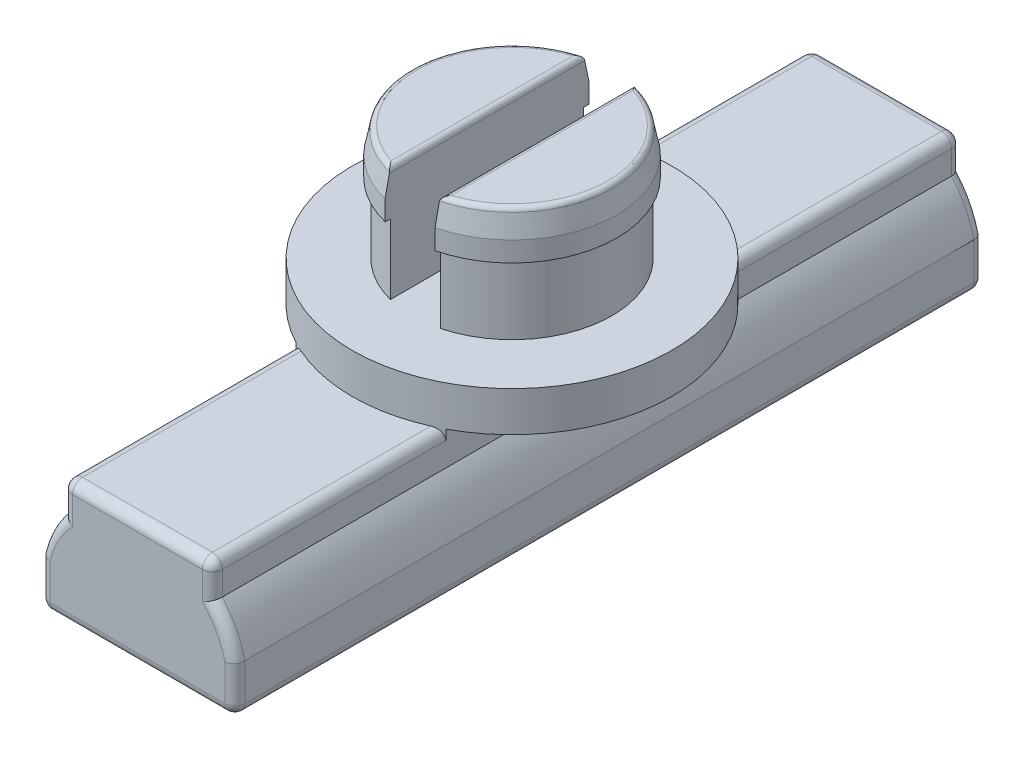
from build123d import *

# Parameters (mm, degrees)
EXTRUDE_2_DEPTH      = 7.5
EXTRUDE_2_DEPTH_BACK = 7.5
SKETCH_3_R           = 3.2
EXTRUDE_3_DEPTH      = 0.8
SKETCH_4_R           = 2
EXTRUDE_4_DEPTH      = 2.3
CUT_EXTRUDE_1_REACH  = 11.892
SKETCH_6_W           = 1
SKETCH_6_H           = 4.523529097
FILLET_1_R           = 0.2
FILLET_2_R           = 0.1


with BuildPart() as part:
    # 草图2 → 凸台-拉伸2 (new, two sides: drawn at the far end of the back side and taken through both)
    with BuildSketch(Plane.XY.offset(-EXTRUDE_2_DEPTH_BACK)):
        with BuildLine():
            Line((-1.95, -2.5), (1.95, -2.5))
            Line((1.95, -2.5), (1.95, -1.555590279))
            ThreePointArc((1.95, -1.555590279), (1.780042303, -1.088161527), (1.5, -0.677124344))
            Line((1.5, -0.677124344), (1.5, 0))
            Line((1.5, 0), (-1.5, 0))
            Line((-1.5, 0), (-1.5, -0.677124344))
            ThreePointArc((-1.5, -0.677124344), (-1.780042303, -1.088161527), (-1.95, -1.555590279))
            Line((-1.95, -1.555590279), (-1.95, -2.5))
        make_face()
    extrude(amount=EXTRUDE_2_DEPTH + EXTRUDE_2_DEPTH_BACK)

    # 草图3 → 凸台-拉伸3 (add)
    with BuildSketch(Plane(origin=(0, 0, 0), x_dir=(1, 0, 0), z_dir=(0, 1, 0))):
        with Locations(Location((0, 0, 0), (0, 0, 62.046813117))):
            Circle(SKETCH_3_R)
    extrude(amount=EXTRUDE_3_DEPTH)

    # 草图4 → 凸台-拉伸4 (add)
    with BuildSketch(Plane(origin=(0, 0.8, 0), x_dir=(1, 0, 0), z_dir=(0, 1, 0))):
        with Locations(Location((0, 0, 0), (0, 0, 270))):
            Circle(SKETCH_4_R)
    extrude(amount=EXTRUDE_4_DEPTH)

    # 草图5 → 旋转1 (revolve)
    with BuildSketch(Plane(origin=(0, 0, 0), x_dir=(0, 0, -1), z_dir=(1, 0, 0))):
        Polygon((-2, 3.1), (-2, 2.2), (-2.1, 2.2), (-2.1, 2.6), align=None)
    revolve(axis=Axis((0, 3.426926784, 0), (0, -1, 0)))

    # 切除-拉伸1: up to this face of the body (flat: up to its plane)
    cut_extrude_1_end = Plane(part.part.faces().sort_by_distance((-1.457573593, 0.8, 2.746708821))[0])
    # 草图6 → 切除-拉伸1 (cut, up to the picked face)
    with BuildSketch(Plane(origin=(0, 3.1, 0), x_dir=(1, 0, 0), z_dir=(0, 1, 0)), mode=Mode.PRIVATE) as cut_extrude_1_sk1:
        with Locations((0, 0.078661768)):
            Rectangle(SKETCH_6_W, SKETCH_6_H)
    cut_extrude_1_tool1 = split(extrude(cut_extrude_1_sk1.sketch, amount=-CUT_EXTRUDE_1_REACH, mode=Mode.PRIVATE), bisect_by=cut_extrude_1_end, keep=Keep.BOTH, mode=Mode.PRIVATE)
    add(cut_extrude_1_tool1.solids().sort_by(Axis((0, 3.1, -0.078662), (0, -1, 0)))[0], mode=Mode.SUBTRACT)

    # 圆角1
    # the kernel refuses this fillet: 0.2 mm, written as the material it takes off along each edge
    with BuildSketch(Plane(origin=(-1.75, -2.3, -7.3), x_dir=(0, -1, 0), z_dir=(-1, 0, 0))) as fillet_1_piece_1_section:
        Polygon((0, 0), (FILLET_1_R * 1.02, 0), (FILLET_1_R * 1.02, -FILLET_1_R * 1.02), (0, -FILLET_1_R * 1.02), align=None)
    fillet_1_piece_1 = extrude(amount=FILLET_1_R * 1.02, mode=Mode.PRIVATE)
    fillet_1_piece_1 = fillet_1_piece_1 - Plane(origin=(-1.75, -2.3, -7.3), x_dir=(0, 0.7071067811865475, 0.7071067811865475), z_dir=(-1, 0, 0)) * Sphere(FILLET_1_R, mode=Mode.PRIVATE)
    add(fillet_1_piece_1, mode=Mode.SUBTRACT)
    with BuildSketch(Plane(origin=(1.75, -2.3, -7.3), x_dir=(0, 0, -1), z_dir=(0, -1, 0))) as fillet_1_piece_2_section:
        Polygon((0, 0), (FILLET_1_R * 1.02, 0), (FILLET_1_R * 1.02, FILLET_1_R * 1.02), (0, FILLET_1_R * 1.02), align=None)
    fillet_1_piece_2 = extrude(amount=FILLET_1_R * 1.02, mode=Mode.PRIVATE)
    fillet_1_piece_2 = fillet_1_piece_2 - Plane(origin=(1.75, -2.3, -7.3), x_dir=(-0.7071067811865475, 0, 0.7071067811865475), z_dir=(0, -1, 0)) * Sphere(FILLET_1_R, mode=Mode.PRIVATE)
    add(fillet_1_piece_2, mode=Mode.SUBTRACT)
    with BuildSketch(Plane(origin=(-1.3, -0.2, -7.3), x_dir=(0, 0, -1), z_dir=(0, 1, 0))) as fillet_1_piece_3_section:
        Polygon((0, 0), (FILLET_1_R * 1.02, 0), (FILLET_1_R * 1.02, FILLET_1_R * 1.02), (0, FILLET_1_R * 1.02), align=None)
    fillet_1_piece_3 = extrude(amount=FILLET_1_R * 1.02, mode=Mode.PRIVATE)
    fillet_1_piece_3 = fillet_1_piece_3 - Plane(origin=(-1.3, -0.2, -7.3), x_dir=(0.7071067811865475, 0, 0.7071067811865475), z_dir=(0, 1, 0)) * Sphere(FILLET_1_R, mode=Mode.PRIVATE)
    add(fillet_1_piece_3, mode=Mode.SUBTRACT)
    with BuildSketch(Plane(origin=(1.3, -0.2, -7.3), x_dir=(0, 1, 0), z_dir=(1, 0, 0))) as fillet_1_piece_4_section:
        Polygon((0, 0), (FILLET_1_R * 1.02, 0), (FILLET_1_R * 1.02, -FILLET_1_R * 1.02), (0, -FILLET_1_R * 1.02), align=None)
    fillet_1_piece_4 = extrude(amount=FILLET_1_R * 1.02, mode=Mode.PRIVATE)
    fillet_1_piece_4 = fillet_1_piece_4 - Plane(origin=(1.3, -0.2, -7.3), x_dir=(0, -0.7071067811865475, 0.7071067811865475), z_dir=(1, 0, 0)) * Sphere(FILLET_1_R, mode=Mode.PRIVATE)
    add(fillet_1_piece_4, mode=Mode.SUBTRACT)
    with BuildSketch(Plane(origin=(1.75, -2.3, 7.3), x_dir=(0, -1, 0), z_dir=(0, 0, 1))) as fillet_1_piece_5_section:
        Polygon((0, 0), (FILLET_1_R * 1.02, 0), (FILLET_1_R * 1.02, FILLET_1_R * 1.02), (0, FILLET_1_R * 1.02), align=None)
    fillet_1_piece_5 = extrude(amount=FILLET_1_R * 1.02, mode=Mode.PRIVATE)
    fillet_1_piece_5 = fillet_1_piece_5 - Plane(origin=(1.75, -2.3, 7.3), x_dir=(-0.7071067811865478, 0.7071067811865472, 0), z_dir=(0, 0, 1)) * Sphere(FILLET_1_R, mode=Mode.PRIVATE)
    add(fillet_1_piece_5, mode=Mode.SUBTRACT)
    with BuildSketch(Plane(origin=(-1.75, -2.3, 7.3), x_dir=(0, 0, 1), z_dir=(-1, 0, 0))) as fillet_1_piece_6_section:
        Polygon((0, 0), (FILLET_1_R * 1.02, 0), (FILLET_1_R * 1.02, -FILLET_1_R * 1.02), (0, -FILLET_1_R * 1.02), align=None)
    fillet_1_piece_6 = extrude(amount=FILLET_1_R * 1.02, mode=Mode.PRIVATE)
    fillet_1_piece_6 = fillet_1_piece_6 - Plane(origin=(-1.75, -2.3, 7.3), x_dir=(0, 0.7071067811865475, -0.7071067811865475), z_dir=(-1, 0, 0)) * Sphere(FILLET_1_R, mode=Mode.PRIVATE)
    add(fillet_1_piece_6, mode=Mode.SUBTRACT)
    with BuildSketch(Plane(origin=(-1.3, -0.2, 7.3), x_dir=(0, 0, 1), z_dir=(0, 1, 0))) as fillet_1_piece_7_section:
        Polygon((0, 0), (FILLET_1_R * 1.02, 0), (FILLET_1_R * 1.02, -FILLET_1_R * 1.02), (0, -FILLET_1_R * 1.02), align=None)
    fillet_1_piece_7 = extrude(amount=FILLET_1_R * 1.02, mode=Mode.PRIVATE)
    fillet_1_piece_7 = fillet_1_piece_7 - Plane(origin=(-1.3, -0.2, 7.3), x_dir=(0.7071067811865475, 0, -0.7071067811865475), z_dir=(0, 1, 0)) * Sphere(FILLET_1_R, mode=Mode.PRIVATE)
    add(fillet_1_piece_7, mode=Mode.SUBTRACT)
    with BuildSketch(Plane(origin=(1.3, -0.2, 7.3), x_dir=(0, 1, 0), z_dir=(1, 0, 0))) as fillet_1_piece_8_section:
        Polygon((0, 0), (FILLET_1_R * 1.02, 0), (FILLET_1_R * 1.02, FILLET_1_R * 1.02), (0, FILLET_1_R * 1.02), align=None)
    fillet_1_piece_8 = extrude(amount=FILLET_1_R * 1.02, mode=Mode.PRIVATE)
    fillet_1_piece_8 = fillet_1_piece_8 - Plane(origin=(1.3, -0.2, 7.3), x_dir=(0, -0.7071067811865475, -0.7071067811865475), z_dir=(1, 0, 0)) * Sphere(FILLET_1_R, mode=Mode.PRIVATE)
    add(fillet_1_piece_8, mode=Mode.SUBTRACT)
    with BuildSketch(Plane(origin=(-1.95, -1.055590279, -7.5), x_dir=(0, 0, 1), z_dir=(0, -1, 0))) as fillet_1_piece_9_section:
        with BuildLine():
            CenterArc((FILLET_1_R, -FILLET_1_R), FILLET_1_R, 90, 90)
            Line((0, -FILLET_1_R), (-FILLET_1_R * 0.02, -FILLET_1_R))
            Line((-FILLET_1_R * 0.02, -FILLET_1_R), (-FILLET_1_R * 0.02, FILLET_1_R * 0.02))
            Line((-FILLET_1_R * 0.02, FILLET_1_R * 0.02), (FILLET_1_R, FILLET_1_R * 0.02))
            Line((FILLET_1_R, FILLET_1_R * 0.02), (FILLET_1_R, 0))
        make_face()
    fillet_1_piece_9 = extrude(amount=1.244409721, mode=Mode.PRIVATE)
    fillet_1_piece_9 = fillet_1_piece_9 & Plane(origin=(0, -2, -7.458467961), x_dir=(-0.7500000000000003, 0.6614378277661473, 0), z_dir=(0, 0, -1)) * Cylinder(2, 4, mode=Mode.PRIVATE)
    add(fillet_1_piece_9, mode=Mode.SUBTRACT)
    with BuildSketch(Plane(origin=(-1.75, -2.5, -7.5), x_dir=(0, 0, 1), z_dir=(1, 0, 0)), Plane(origin=(-1.75, -2.5, 7.5), x_dir=(0, 1, 0), z_dir=(1, 0, 0))) as fillet_1_piece_10:
        with BuildLine():
            CenterArc((FILLET_1_R, -FILLET_1_R), FILLET_1_R, 90, 90)
            Line((0, -FILLET_1_R), (-FILLET_1_R * 0.02, -FILLET_1_R))
            Line((-FILLET_1_R * 0.02, -FILLET_1_R), (-FILLET_1_R * 0.02, FILLET_1_R * 0.02))
            Line((-FILLET_1_R * 0.02, FILLET_1_R * 0.02), (FILLET_1_R, FILLET_1_R * 0.02))
            Line((FILLET_1_R, FILLET_1_R * 0.02), (FILLET_1_R, 0))
        make_face()
    extrude(amount=3.5, mode=Mode.SUBTRACT)
    with BuildSketch(Plane(origin=(-1.5, 0, -2.326658805), x_dir=(0, -1, 0), z_dir=(0, 0, -1))) as fillet_1_piece_11_section:
        with BuildLine():
            CenterArc((FILLET_1_R, -FILLET_1_R), FILLET_1_R, 90, 90)
            Line((0, -FILLET_1_R), (-FILLET_1_R * 0.02, -FILLET_1_R))
            Line((-FILLET_1_R * 0.02, -FILLET_1_R), (-FILLET_1_R * 0.02, FILLET_1_R * 0.02))
            Line((-FILLET_1_R * 0.02, FILLET_1_R * 0.02), (FILLET_1_R, FILLET_1_R * 0.02))
            Line((FILLET_1_R, FILLET_1_R * 0.02), (FILLET_1_R, 0))
        make_face()
    fillet_1_piece_11 = extrude(amount=4.973341195, mode=Mode.PRIVATE)
    fillet_1_piece_11 = split(fillet_1_piece_11, bisect_by=Plane(origin=(-1.459470177, 0, -5.073738794), z_dir=(0, -1, 0)), keep=Keep.TOP, mode=Mode.PRIVATE)
    fillet_1_piece_11 = fillet_1_piece_11 - Plane(origin=(0, -0.049499439, 0), x_dir=(0.46874999999412414, 0, -0.8833308765720287), z_dir=(0, -1, 0)) * Cylinder(3.2, 11, mode=Mode.PRIVATE)
    add(fillet_1_piece_11, mode=Mode.SUBTRACT)
    with BuildSketch(Plane(origin=(1.5, 0, -7.3), x_dir=(0, -1, 0), z_dir=(0, 0, 1))) as fillet_1_piece_12_section:
        with BuildLine():
            CenterArc((FILLET_1_R, -FILLET_1_R), FILLET_1_R, 90, 90)
            Line((0, -FILLET_1_R), (-FILLET_1_R * 0.02, -FILLET_1_R))
            Line((-FILLET_1_R * 0.02, -FILLET_1_R), (-FILLET_1_R * 0.02, FILLET_1_R * 0.02))
            Line((-FILLET_1_R * 0.02, FILLET_1_R * 0.02), (FILLET_1_R, FILLET_1_R * 0.02))
            Line((FILLET_1_R, FILLET_1_R * 0.02), (FILLET_1_R, 0))
        make_face()
    fillet_1_piece_12 = extrude(amount=4.973341195, mode=Mode.PRIVATE)
    fillet_1_piece_12 = split(fillet_1_piece_12, bisect_by=Plane(origin=(1.459470177, 0, -5.073738786), z_dir=(0, -1, 0)), keep=Keep.TOP, mode=Mode.PRIVATE)
    fillet_1_piece_12 = fillet_1_piece_12 - Plane(origin=(0, -0.04949944, 0), x_dir=(0.46874999999412414, 0, -0.8833308765720287), z_dir=(0, -1, 0)) * Cylinder(3.2, 11, mode=Mode.PRIVATE)
    add(fillet_1_piece_12, mode=Mode.SUBTRACT)
    with BuildSketch(Plane(origin=(1.95, -2.5, -7.3), x_dir=(-1, 0, 0), z_dir=(0, 0, 1)), Plane(origin=(-1.95, -2.5, -7.3), x_dir=(0, 1, 0), z_dir=(0, 0, 1))) as fillet_1_piece_13:
        with BuildLine():
            CenterArc((FILLET_1_R, -FILLET_1_R), FILLET_1_R, 90, 90)
            Line((0, -FILLET_1_R), (-FILLET_1_R * 0.02, -FILLET_1_R))
            Line((-FILLET_1_R * 0.02, -FILLET_1_R), (-FILLET_1_R * 0.02, FILLET_1_R * 0.02))
            Line((-FILLET_1_R * 0.02, FILLET_1_R * 0.02), (FILLET_1_R, FILLET_1_R * 0.02))
            Line((FILLET_1_R, FILLET_1_R * 0.02), (FILLET_1_R, 0))
        make_face()
    extrude(amount=14.6, mode=Mode.SUBTRACT)
    with BuildSketch(Plane(origin=(1.95, -2.3, -7.5), x_dir=(-1, 0, 0), z_dir=(0, 1, 0))) as fillet_1_piece_14_section:
        with BuildLine():
            CenterArc((FILLET_1_R, FILLET_1_R), FILLET_1_R, 180, 90)
            Line((0, FILLET_1_R), (-FILLET_1_R * 0.02, FILLET_1_R))
            Line((-FILLET_1_R * 0.02, FILLET_1_R), (-FILLET_1_R * 0.02, -FILLET_1_R * 0.02))
            Line((-FILLET_1_R * 0.02, -FILLET_1_R * 0.02), (FILLET_1_R, -FILLET_1_R * 0.02))
            Line((FILLET_1_R, -FILLET_1_R * 0.02), (FILLET_1_R, 0))
        make_face()
    fillet_1_piece_14 = extrude(amount=1.244409721, mode=Mode.PRIVATE)
    fillet_1_piece_14 = fillet_1_piece_14 & Plane(origin=(0, -2, -7.458467726), x_dir=(0.9749999999999994, 0.22220486043289284, 0), z_dir=(0, 0, -1)) * Cylinder(2, 4, mode=Mode.PRIVATE)
    add(fillet_1_piece_14, mode=Mode.SUBTRACT)
    with BuildSketch(Plane(origin=(0, -2, -7.5), x_dir=(0.9996637110682526, -0.025931925752815457, 0), z_dir=(-0.025931925752815457, -0.9996637110682526, 0))) as fillet_1_piece_15_section:
        with BuildLine():
            CenterArc((2 - FILLET_1_R, FILLET_1_R), FILLET_1_R, 270, 90)
            Line((2, FILLET_1_R), (2 + FILLET_1_R * 0.02, FILLET_1_R))
            Line((2 + FILLET_1_R * 0.02, FILLET_1_R), (2 + FILLET_1_R * 0.02, -FILLET_1_R * 0.02))
            Line((2 + FILLET_1_R * 0.02, -FILLET_1_R * 0.02), (2 - FILLET_1_R, -FILLET_1_R * 0.02))
            Line((2 - FILLET_1_R, -FILLET_1_R * 0.02), (2 - FILLET_1_R, 0))
        make_face()
    fillet_1_piece_15 = revolve(axis=Axis((0, -2, -7.5), (0, 0, 1)), revolution_arc=57.220103199, mode=Mode.PRIVATE)
    fillet_1_piece_15 = split(fillet_1_piece_15, bisect_by=Plane(origin=(1.95, -1.33665989, -7.443033327), z_dir=(-1, 0, 0)), keep=Keep.TOP, mode=Mode.PRIVATE)
    fillet_1_piece_15 = split(fillet_1_piece_15, bisect_by=Plane(origin=(1.5, -1.33665989, -7.443033327), z_dir=(1, 0, 0)), keep=Keep.TOP, mode=Mode.PRIVATE)
    add(fillet_1_piece_15, mode=Mode.SUBTRACT)
    with BuildSketch(Plane(origin=(1.5, -1.177124344, -7.5), x_dir=(-1, 0, 0), z_dir=(0, 1, 0))) as fillet_1_piece_16_section:
        with BuildLine():
            CenterArc((FILLET_1_R, FILLET_1_R), FILLET_1_R, 180, 90)
            Line((0, FILLET_1_R), (-FILLET_1_R * 0.02, FILLET_1_R))
            Line((-FILLET_1_R * 0.02, FILLET_1_R), (-FILLET_1_R * 0.02, -FILLET_1_R * 0.02))
            Line((-FILLET_1_R * 0.02, -FILLET_1_R * 0.02), (FILLET_1_R, -FILLET_1_R * 0.02))
            Line((FILLET_1_R, -FILLET_1_R * 0.02), (FILLET_1_R, 0))
        make_face()
    fillet_1_piece_16 = extrude(amount=0.977124344, mode=Mode.PRIVATE)
    fillet_1_piece_16 = fillet_1_piece_16 - Plane(origin=(0, -2, -7.452053355), x_dir=(0.9749999999999994, 0.22220486043289284, 0), z_dir=(0, 0, -1)) * Cylinder(2, 3, mode=Mode.PRIVATE)
    add(fillet_1_piece_16, mode=Mode.SUBTRACT)
    with BuildSketch(Plane(origin=(-1.5, -0.2, 7.5), x_dir=(1, 0, 0), z_dir=(0, -1, 0))) as fillet_1_piece_17_section:
        with BuildLine():
            CenterArc((FILLET_1_R, -FILLET_1_R), FILLET_1_R, 90, 90)
            Line((0, -FILLET_1_R), (-FILLET_1_R * 0.02, -FILLET_1_R))
            Line((-FILLET_1_R * 0.02, -FILLET_1_R), (-FILLET_1_R * 0.02, FILLET_1_R * 0.02))
            Line((-FILLET_1_R * 0.02, FILLET_1_R * 0.02), (FILLET_1_R, FILLET_1_R * 0.02))
            Line((FILLET_1_R, FILLET_1_R * 0.02), (FILLET_1_R, 0))
        make_face()
    fillet_1_piece_17 = extrude(amount=0.977124344, mode=Mode.PRIVATE)
    fillet_1_piece_17 = fillet_1_piece_17 - Plane(origin=(0, -2, 7.452053317), x_dir=(-0.7500000000000003, 0.6614378277661473, 0), z_dir=(0, 0, -1)) * Cylinder(2, 3, mode=Mode.PRIVATE)
    add(fillet_1_piece_17, mode=Mode.SUBTRACT)
    with BuildSketch(Plane(origin=(0, -2, 7.5), x_dir=(-0.5630336167990329, 0.8264339939488209, 0), z_dir=(0.8264339939488209, 0.5630336167990329, 0))) as fillet_1_piece_18_section:
        with BuildLine():
            CenterArc((2 - FILLET_1_R, -FILLET_1_R), FILLET_1_R, 0, 90)
            Line((2 - FILLET_1_R, 0), (2 - FILLET_1_R, FILLET_1_R * 0.02))
            Line((2 - FILLET_1_R, FILLET_1_R * 0.02), (2 + FILLET_1_R * 0.02, FILLET_1_R * 0.02))
            Line((2 + FILLET_1_R * 0.02, FILLET_1_R * 0.02), (2 + FILLET_1_R * 0.02, -FILLET_1_R))
            Line((2 + FILLET_1_R * 0.02, -FILLET_1_R), (2, -FILLET_1_R))
        make_face()
    fillet_1_piece_18 = revolve(axis=Axis((0, -2, 7.5), (0, 0, 1)), revolution_arc=57.220103199, mode=Mode.PRIVATE)
    fillet_1_piece_18 = split(fillet_1_piece_18, bisect_by=Plane(origin=(-1.95, -1.33665989, 7.443033328), z_dir=(1, 0, 0)), keep=Keep.TOP, mode=Mode.PRIVATE)
    fillet_1_piece_18 = split(fillet_1_piece_18, bisect_by=Plane(origin=(-1.5, -1.33665989, 7.443033328), z_dir=(-1, 0, 0)), keep=Keep.TOP, mode=Mode.PRIVATE)
    add(fillet_1_piece_18, mode=Mode.SUBTRACT)
    with BuildSketch(Plane(origin=(-1.95, -1.055590279, 7.5), x_dir=(0, 0, -1), z_dir=(0, -1, 0))) as fillet_1_piece_19_section:
        with BuildLine():
            CenterArc((FILLET_1_R, FILLET_1_R), FILLET_1_R, 180, 90)
            Line((0, FILLET_1_R), (-FILLET_1_R * 0.02, FILLET_1_R))
            Line((-FILLET_1_R * 0.02, FILLET_1_R), (-FILLET_1_R * 0.02, -FILLET_1_R * 0.02))
            Line((-FILLET_1_R * 0.02, -FILLET_1_R * 0.02), (FILLET_1_R, -FILLET_1_R * 0.02))
            Line((FILLET_1_R, -FILLET_1_R * 0.02), (FILLET_1_R, 0))
        make_face()
    fillet_1_piece_19 = extrude(amount=1.244409721, mode=Mode.PRIVATE)
    fillet_1_piece_19 = fillet_1_piece_19 & Plane(origin=(0, -2, 7.458467961), x_dir=(-0.7500000000000003, 0.6614378277661473, 0), z_dir=(0, 0, -1)) * Cylinder(2, 4, mode=Mode.PRIVATE)
    add(fillet_1_piece_19, mode=Mode.SUBTRACT)
    with BuildSketch(Plane(origin=(1.95, -2.3, 7.5), x_dir=(-1, 0, 0), z_dir=(0, 1, 0))) as fillet_1_piece_20_section:
        with BuildLine():
            CenterArc((FILLET_1_R, -FILLET_1_R), FILLET_1_R, 90, 90)
            Line((0, -FILLET_1_R), (-FILLET_1_R * 0.02, -FILLET_1_R))
            Line((-FILLET_1_R * 0.02, -FILLET_1_R), (-FILLET_1_R * 0.02, FILLET_1_R * 0.02))
            Line((-FILLET_1_R * 0.02, FILLET_1_R * 0.02), (FILLET_1_R, FILLET_1_R * 0.02))
            Line((FILLET_1_R, FILLET_1_R * 0.02), (FILLET_1_R, 0))
        make_face()
    fillet_1_piece_20 = extrude(amount=1.244409721, mode=Mode.PRIVATE)
    fillet_1_piece_20 = fillet_1_piece_20 & Plane(origin=(0, -2, 7.458467726), x_dir=(0.9749999999999994, 0.22220486043289284, 0), z_dir=(0, 0, -1)) * Cylinder(2, 4, mode=Mode.PRIVATE)
    add(fillet_1_piece_20, mode=Mode.SUBTRACT)
    with BuildSketch(Plane(origin=(0, -2, 7.5), x_dir=(0.9996637110682526, -0.025931925752815457, 0), z_dir=(-0.025931925752815457, -0.9996637110682526, 0))) as fillet_1_piece_21_section:
        with BuildLine():
            CenterArc((2 - FILLET_1_R, -FILLET_1_R), FILLET_1_R, 0, 90)
            Line((2, -FILLET_1_R), (2 + FILLET_1_R * 0.02, -FILLET_1_R))
            Line((2 + FILLET_1_R * 0.02, -FILLET_1_R), (2 + FILLET_1_R * 0.02, FILLET_1_R * 0.02))
            Line((2 + FILLET_1_R * 0.02, FILLET_1_R * 0.02), (2 - FILLET_1_R, FILLET_1_R * 0.02))
            Line((2 - FILLET_1_R, FILLET_1_R * 0.02), (2 - FILLET_1_R, 0))
        make_face()
    fillet_1_piece_21 = revolve(axis=Axis((0, -2, 7.5), (0, 0, 1)), revolution_arc=57.220103199, mode=Mode.PRIVATE)
    fillet_1_piece_21 = split(fillet_1_piece_21, bisect_by=Plane(origin=(1.95, -1.33665989, 7.443033327), z_dir=(-1, 0, 0)), keep=Keep.TOP, mode=Mode.PRIVATE)
    fillet_1_piece_21 = split(fillet_1_piece_21, bisect_by=Plane(origin=(1.5, -1.33665989, 7.443033327), z_dir=(1, 0, 0)), keep=Keep.TOP, mode=Mode.PRIVATE)
    add(fillet_1_piece_21, mode=Mode.SUBTRACT)
    with BuildSketch(Plane(origin=(1.5, -1.177124344, 7.5), x_dir=(-1, 0, 0), z_dir=(0, 1, 0))) as fillet_1_piece_22_section:
        with BuildLine():
            CenterArc((FILLET_1_R, -FILLET_1_R), FILLET_1_R, 90, 90)
            Line((0, -FILLET_1_R), (-FILLET_1_R * 0.02, -FILLET_1_R))
            Line((-FILLET_1_R * 0.02, -FILLET_1_R), (-FILLET_1_R * 0.02, FILLET_1_R * 0.02))
            Line((-FILLET_1_R * 0.02, FILLET_1_R * 0.02), (FILLET_1_R, FILLET_1_R * 0.02))
            Line((FILLET_1_R, FILLET_1_R * 0.02), (FILLET_1_R, 0))
        make_face()
    fillet_1_piece_22 = extrude(amount=0.977124344, mode=Mode.PRIVATE)
    fillet_1_piece_22 = fillet_1_piece_22 - Plane(origin=(0, -2, 7.452053355), x_dir=(0.9749999999999994, 0.22220486043289284, 0), z_dir=(0, 0, -1)) * Cylinder(2, 3, mode=Mode.PRIVATE)
    add(fillet_1_piece_22, mode=Mode.SUBTRACT)
    with BuildSketch(Plane(origin=(1.3, 0, 7.5), x_dir=(0, -1, 0), z_dir=(-1, 0, 0))) as fillet_1_piece_23:
        with BuildLine():
            CenterArc((FILLET_1_R, -FILLET_1_R), FILLET_1_R, 90, 90)
            Line((0, -FILLET_1_R), (-FILLET_1_R * 0.02, -FILLET_1_R))
            Line((-FILLET_1_R * 0.02, -FILLET_1_R), (-FILLET_1_R * 0.02, FILLET_1_R * 0.02))
            Line((-FILLET_1_R * 0.02, FILLET_1_R * 0.02), (FILLET_1_R, FILLET_1_R * 0.02))
            Line((FILLET_1_R, FILLET_1_R * 0.02), (FILLET_1_R, 0))
        make_face()
    extrude(amount=2.6, mode=Mode.SUBTRACT)
    with BuildSketch(Plane(origin=(1.3, 0, -7.5), x_dir=(0, -1, 0), z_dir=(-1, 0, 0))) as fillet_1_piece_24:
        with BuildLine():
            CenterArc((FILLET_1_R, FILLET_1_R), FILLET_1_R, 180, 90)
            Line((0, FILLET_1_R), (-FILLET_1_R * 0.02, FILLET_1_R))
            Line((-FILLET_1_R * 0.02, FILLET_1_R), (-FILLET_1_R * 0.02, -FILLET_1_R * 0.02))
            Line((-FILLET_1_R * 0.02, -FILLET_1_R * 0.02), (FILLET_1_R, -FILLET_1_R * 0.02))
            Line((FILLET_1_R, -FILLET_1_R * 0.02), (FILLET_1_R, 0))
        make_face()
    extrude(amount=2.6, mode=Mode.SUBTRACT)
    with BuildSketch(Plane(origin=(-1.5, -0.2, -7.5), x_dir=(1, 0, 0), z_dir=(0, -1, 0))) as fillet_1_piece_25_section:
        with BuildLine():
            CenterArc((FILLET_1_R, FILLET_1_R), FILLET_1_R, 180, 90)
            Line((0, FILLET_1_R), (-FILLET_1_R * 0.02, FILLET_1_R))
            Line((-FILLET_1_R * 0.02, FILLET_1_R), (-FILLET_1_R * 0.02, -FILLET_1_R * 0.02))
            Line((-FILLET_1_R * 0.02, -FILLET_1_R * 0.02), (FILLET_1_R, -FILLET_1_R * 0.02))
            Line((FILLET_1_R, -FILLET_1_R * 0.02), (FILLET_1_R, 0))
        make_face()
    fillet_1_piece_25 = extrude(amount=0.977124344, mode=Mode.PRIVATE)
    fillet_1_piece_25 = fillet_1_piece_25 - Plane(origin=(0, -2, -7.452053317), x_dir=(-0.7500000000000003, 0.6614378277661473, 0), z_dir=(0, 0, -1)) * Cylinder(2, 3, mode=Mode.PRIVATE)
    add(fillet_1_piece_25, mode=Mode.SUBTRACT)
    with BuildSketch(Plane(origin=(-1.5, 0, 7.3), x_dir=(0, -1, 0), z_dir=(0, 0, -1))) as fillet_1_piece_26_section:
        with BuildLine():
            CenterArc((FILLET_1_R, -FILLET_1_R), FILLET_1_R, 90, 90)
            Line((0, -FILLET_1_R), (-FILLET_1_R * 0.02, -FILLET_1_R))
            Line((-FILLET_1_R * 0.02, -FILLET_1_R), (-FILLET_1_R * 0.02, FILLET_1_R * 0.02))
            Line((-FILLET_1_R * 0.02, FILLET_1_R * 0.02), (FILLET_1_R, FILLET_1_R * 0.02))
            Line((FILLET_1_R, FILLET_1_R * 0.02), (FILLET_1_R, 0))
        make_face()
    fillet_1_piece_26 = extrude(amount=4.973341195, mode=Mode.PRIVATE)
    fillet_1_piece_26 = split(fillet_1_piece_26, bisect_by=Plane(origin=(-1.459470177, 0, 5.073738794), z_dir=(0, -1, 0)), keep=Keep.TOP, mode=Mode.PRIVATE)
    fillet_1_piece_26 = fillet_1_piece_26 - Plane(origin=(0, -0.049499439, 0), x_dir=(0.46874999999412414, 0, -0.8833308765720287), z_dir=(0, -1, 0)) * Cylinder(3.2, 11, mode=Mode.PRIVATE)
    add(fillet_1_piece_26, mode=Mode.SUBTRACT)
    with BuildSketch(Plane(origin=(1.5, 0, 2.326658805), x_dir=(0, -1, 0), z_dir=(0, 0, 1))) as fillet_1_piece_27_section:
        with BuildLine():
            CenterArc((FILLET_1_R, -FILLET_1_R), FILLET_1_R, 90, 90)
            Line((0, -FILLET_1_R), (-FILLET_1_R * 0.02, -FILLET_1_R))
            Line((-FILLET_1_R * 0.02, -FILLET_1_R), (-FILLET_1_R * 0.02, FILLET_1_R * 0.02))
            Line((-FILLET_1_R * 0.02, FILLET_1_R * 0.02), (FILLET_1_R, FILLET_1_R * 0.02))
            Line((FILLET_1_R, FILLET_1_R * 0.02), (FILLET_1_R, 0))
        make_face()
    fillet_1_piece_27 = extrude(amount=4.973341195, mode=Mode.PRIVATE)
    fillet_1_piece_27 = split(fillet_1_piece_27, bisect_by=Plane(origin=(1.45947017, 0, 5.073738515), z_dir=(0, -1, 0)), keep=Keep.TOP, mode=Mode.PRIVATE)
    fillet_1_piece_27 = fillet_1_piece_27 - Plane(origin=(0, -0.04949946, 0), x_dir=(0.46874999999412414, 0, -0.8833308765720287), z_dir=(0, -1, 0)) * Cylinder(3.2, 11, mode=Mode.PRIVATE)
    add(fillet_1_piece_27, mode=Mode.SUBTRACT)
    with BuildSketch(Plane(origin=(0, -2, -7.5), x_dir=(-0.5630336167990329, 0.8264339939488209, 0), z_dir=(0.8264339939488209, 0.5630336167990329, 0))) as fillet_1_piece_28_section:
        with BuildLine():
            CenterArc((2 - FILLET_1_R, FILLET_1_R), FILLET_1_R, 270, 90)
            Line((2 - FILLET_1_R, 0), (2 - FILLET_1_R, -FILLET_1_R * 0.02))
            Line((2 - FILLET_1_R, -FILLET_1_R * 0.02), (2 + FILLET_1_R * 0.02, -FILLET_1_R * 0.02))
            Line((2 + FILLET_1_R * 0.02, -FILLET_1_R * 0.02), (2 + FILLET_1_R * 0.02, FILLET_1_R))
            Line((2 + FILLET_1_R * 0.02, FILLET_1_R), (2, FILLET_1_R))
        make_face()
    fillet_1_piece_28 = revolve(axis=Axis((0, -2, -7.5), (0, 0, 1)), revolution_arc=57.220103199, mode=Mode.PRIVATE)
    fillet_1_piece_28 = split(fillet_1_piece_28, bisect_by=Plane(origin=(-1.95, -1.33665989, -7.443033328), z_dir=(1, 0, 0)), keep=Keep.TOP, mode=Mode.PRIVATE)
    fillet_1_piece_28 = split(fillet_1_piece_28, bisect_by=Plane(origin=(-1.5, -1.33665989, -7.443033328), z_dir=(-1, 0, 0)), keep=Keep.TOP, mode=Mode.PRIVATE)
    add(fillet_1_piece_28, mode=Mode.SUBTRACT)
    with BuildSketch(Plane(origin=(-1.95, -1.055590279, -7.5), x_dir=(0, 0, 1), z_dir=(0, -1, 0))) as fillet_1_piece_29a_section:
        with BuildLine():
            CenterArc((FILLET_1_R, -FILLET_1_R), FILLET_1_R, 90, 90)
            Line((0, -FILLET_1_R), (-FILLET_1_R * 0.02, -FILLET_1_R))
            Line((-FILLET_1_R * 0.02, -FILLET_1_R), (-FILLET_1_R * 0.02, FILLET_1_R * 0.02))
            Line((-FILLET_1_R * 0.02, FILLET_1_R * 0.02), (FILLET_1_R, FILLET_1_R * 0.02))
            Line((FILLET_1_R, FILLET_1_R * 0.02), (FILLET_1_R, 0))
        make_face()
    fillet_1_piece_29a = extrude(amount=1.244409721, mode=Mode.PRIVATE)
    fillet_1_piece_29a = fillet_1_piece_29a - Plane(origin=(0, -2, -7.445118961), x_dir=(-0.7500000000000003, 0.6614378277661473, 0), z_dir=(0, 0, -1)) * Cylinder(2, 4, mode=Mode.PRIVATE)
    with BuildSketch(Plane(origin=(0, -2, -7.5), x_dir=(-0.5630336167990329, 0.8264339939488209, 0), z_dir=(0.8264339939488209, 0.5630336167990329, 0))) as fillet_1_piece_29b_section:
        with BuildLine():
            CenterArc((2 - FILLET_1_R, FILLET_1_R), FILLET_1_R, 270, 90)
            Line((2 - FILLET_1_R, 0), (2 - FILLET_1_R, -FILLET_1_R * 0.02))
            Line((2 - FILLET_1_R, -FILLET_1_R * 0.02), (2 + FILLET_1_R * 0.02, -FILLET_1_R * 0.02))
            Line((2 + FILLET_1_R * 0.02, -FILLET_1_R * 0.02), (2 + FILLET_1_R * 0.02, FILLET_1_R))
            Line((2 + FILLET_1_R * 0.02, FILLET_1_R), (2, FILLET_1_R))
        make_face()
    fillet_1_piece_29b = revolve(axis=Axis((0, -2, -7.5), (0, 0, 1)), revolution_arc=57.220103199, mode=Mode.PRIVATE)
    fillet_1_piece_29b = split(fillet_1_piece_29b, bisect_by=Plane(origin=(-1.95, -1.842191544, -7.433053359), z_dir=(-1, 0, 0)), keep=Keep.TOP, mode=Mode.PRIVATE)
    fillet_1_piece_29 = fillet_1_piece_29a & fillet_1_piece_29b
    add(fillet_1_piece_29, mode=Mode.SUBTRACT)
    with BuildSketch(Plane(origin=(1.95, -2.3, -7.5), x_dir=(-1, 0, 0), z_dir=(0, 1, 0))) as fillet_1_piece_30a_section:
        with BuildLine():
            CenterArc((FILLET_1_R, FILLET_1_R), FILLET_1_R, 180, 90)
            Line((0, FILLET_1_R), (-FILLET_1_R * 0.02, FILLET_1_R))
            Line((-FILLET_1_R * 0.02, FILLET_1_R), (-FILLET_1_R * 0.02, -FILLET_1_R * 0.02))
            Line((-FILLET_1_R * 0.02, -FILLET_1_R * 0.02), (FILLET_1_R, -FILLET_1_R * 0.02))
            Line((FILLET_1_R, -FILLET_1_R * 0.02), (FILLET_1_R, 0))
        make_face()
    fillet_1_piece_30a = extrude(amount=1.244409721, mode=Mode.PRIVATE)
    fillet_1_piece_30a = fillet_1_piece_30a - Plane(origin=(0, -2, -7.445118123), x_dir=(0.9749999999999994, 0.22220486043289284, 0), z_dir=(0, 0, -1)) * Cylinder(2, 4, mode=Mode.PRIVATE)
    with BuildSketch(Plane(origin=(0, -2, -7.5), x_dir=(0.9996637110682526, -0.025931925752815457, 0), z_dir=(-0.025931925752815457, -0.9996637110682526, 0))) as fillet_1_piece_30b_section:
        with BuildLine():
            CenterArc((2 - FILLET_1_R, FILLET_1_R), FILLET_1_R, 270, 90)
            Line((2, FILLET_1_R), (2 + FILLET_1_R * 0.02, FILLET_1_R))
            Line((2 + FILLET_1_R * 0.02, FILLET_1_R), (2 + FILLET_1_R * 0.02, -FILLET_1_R * 0.02))
            Line((2 + FILLET_1_R * 0.02, -FILLET_1_R * 0.02), (2 - FILLET_1_R, -FILLET_1_R * 0.02))
            Line((2 - FILLET_1_R, -FILLET_1_R * 0.02), (2 - FILLET_1_R, 0))
        make_face()
    fillet_1_piece_30b = revolve(axis=Axis((0, -2, -7.5), (0, 0, 1)), revolution_arc=57.220103199, mode=Mode.PRIVATE)
    fillet_1_piece_30b = split(fillet_1_piece_30b, bisect_by=Plane(origin=(1.95, -1.842191541, -7.433053357), z_dir=(1, 0, 0)), keep=Keep.TOP, mode=Mode.PRIVATE)
    fillet_1_piece_30 = fillet_1_piece_30a & fillet_1_piece_30b
    add(fillet_1_piece_30, mode=Mode.SUBTRACT)
    with BuildSketch(Plane(origin=(0, -2, -7.5), x_dir=(0.9996637110682526, -0.025931925752815457, 0), z_dir=(-0.025931925752815457, -0.9996637110682526, 0))) as fillet_1_piece_31a_section:
        with BuildLine():
            CenterArc((2 - FILLET_1_R, FILLET_1_R), FILLET_1_R, 270, 90)
            Line((2, FILLET_1_R), (2 + FILLET_1_R * 0.02, FILLET_1_R))
            Line((2 + FILLET_1_R * 0.02, FILLET_1_R), (2 + FILLET_1_R * 0.02, -FILLET_1_R * 0.02))
            Line((2 + FILLET_1_R * 0.02, -FILLET_1_R * 0.02), (2 - FILLET_1_R, -FILLET_1_R * 0.02))
            Line((2 - FILLET_1_R, -FILLET_1_R * 0.02), (2 - FILLET_1_R, 0))
        make_face()
    fillet_1_piece_31a = revolve(axis=Axis((0, -2, -7.5), (0, 0, 1)), revolution_arc=57.220103199, mode=Mode.PRIVATE)
    fillet_1_piece_31a = split(fillet_1_piece_31a, bisect_by=Plane(origin=(1.5, -0.560663282, -7.456618179), z_dir=(-1, 0, 0)), keep=Keep.TOP, mode=Mode.PRIVATE)
    with BuildSketch(Plane(origin=(1.5, -1.177124344, -7.5), x_dir=(-1, 0, 0), z_dir=(0, 1, 0))) as fillet_1_piece_31b_section:
        with BuildLine():
            CenterArc((FILLET_1_R, FILLET_1_R), FILLET_1_R, 180, 90)
            Line((0, FILLET_1_R), (-FILLET_1_R * 0.02, FILLET_1_R))
            Line((-FILLET_1_R * 0.02, FILLET_1_R), (-FILLET_1_R * 0.02, -FILLET_1_R * 0.02))
            Line((-FILLET_1_R * 0.02, -FILLET_1_R * 0.02), (FILLET_1_R, -FILLET_1_R * 0.02))
            Line((FILLET_1_R, -FILLET_1_R * 0.02), (FILLET_1_R, 0))
        make_face()
    fillet_1_piece_31b = extrude(amount=0.977124344, mode=Mode.PRIVATE)
    fillet_1_piece_31b = fillet_1_piece_31b & Plane(origin=(0, -2, -7.456807859), x_dir=(0.9749999999999994, 0.22220486043289284, 0), z_dir=(0, 0, -1)) * Cylinder(2, 3, mode=Mode.PRIVATE)
    fillet_1_piece_31 = fillet_1_piece_31a & fillet_1_piece_31b
    add(fillet_1_piece_31, mode=Mode.SUBTRACT)
    with BuildSketch(Plane(origin=(0, -2, 7.5), x_dir=(-0.5630336167990329, 0.8264339939488209, 0), z_dir=(0.8264339939488209, 0.5630336167990329, 0))) as fillet_1_piece_32a_section:
        with BuildLine():
            CenterArc((2 - FILLET_1_R, -FILLET_1_R), FILLET_1_R, 0, 90)
            Line((2 - FILLET_1_R, 0), (2 - FILLET_1_R, FILLET_1_R * 0.02))
            Line((2 - FILLET_1_R, FILLET_1_R * 0.02), (2 + FILLET_1_R * 0.02, FILLET_1_R * 0.02))
            Line((2 + FILLET_1_R * 0.02, FILLET_1_R * 0.02), (2 + FILLET_1_R * 0.02, -FILLET_1_R))
            Line((2 + FILLET_1_R * 0.02, -FILLET_1_R), (2, -FILLET_1_R))
        make_face()
    fillet_1_piece_32a = revolve(axis=Axis((0, -2, 7.5), (0, 0, 1)), revolution_arc=57.220103199, mode=Mode.PRIVATE)
    fillet_1_piece_32a = split(fillet_1_piece_32a, bisect_by=Plane(origin=(-1.5, -0.560664159, 7.456618289), z_dir=(1, 0, 0)), keep=Keep.TOP, mode=Mode.PRIVATE)
    with BuildSketch(Plane(origin=(-1.5, -0.2, 7.5), x_dir=(1, 0, 0), z_dir=(0, -1, 0))) as fillet_1_piece_32b_section:
        with BuildLine():
            CenterArc((FILLET_1_R, -FILLET_1_R), FILLET_1_R, 90, 90)
            Line((0, -FILLET_1_R), (-FILLET_1_R * 0.02, -FILLET_1_R))
            Line((-FILLET_1_R * 0.02, -FILLET_1_R), (-FILLET_1_R * 0.02, FILLET_1_R * 0.02))
            Line((-FILLET_1_R * 0.02, FILLET_1_R * 0.02), (FILLET_1_R, FILLET_1_R * 0.02))
            Line((FILLET_1_R, FILLET_1_R * 0.02), (FILLET_1_R, 0))
        make_face()
    fillet_1_piece_32b = extrude(amount=0.977124344, mode=Mode.PRIVATE)
    fillet_1_piece_32b = fillet_1_piece_32b & Plane(origin=(0, -2, 7.456807822), x_dir=(-0.7500000000000003, 0.6614378277661473, 0), z_dir=(0, 0, -1)) * Cylinder(2, 3, mode=Mode.PRIVATE)
    fillet_1_piece_32 = fillet_1_piece_32a & fillet_1_piece_32b
    add(fillet_1_piece_32, mode=Mode.SUBTRACT)
    with BuildSketch(Plane(origin=(-1.95, -1.055590279, 7.5), x_dir=(0, 0, -1), z_dir=(0, -1, 0))) as fillet_1_piece_33a_section:
        with BuildLine():
            CenterArc((FILLET_1_R, FILLET_1_R), FILLET_1_R, 180, 90)
            Line((0, FILLET_1_R), (-FILLET_1_R * 0.02, FILLET_1_R))
            Line((-FILLET_1_R * 0.02, FILLET_1_R), (-FILLET_1_R * 0.02, -FILLET_1_R * 0.02))
            Line((-FILLET_1_R * 0.02, -FILLET_1_R * 0.02), (FILLET_1_R, -FILLET_1_R * 0.02))
            Line((FILLET_1_R, -FILLET_1_R * 0.02), (FILLET_1_R, 0))
        make_face()
    fillet_1_piece_33a = extrude(amount=1.244409721, mode=Mode.PRIVATE)
    fillet_1_piece_33a = fillet_1_piece_33a - Plane(origin=(0, -2, 7.445118961), x_dir=(-0.7500000000000003, 0.6614378277661473, 0), z_dir=(0, 0, -1)) * Cylinder(2, 4, mode=Mode.PRIVATE)
    with BuildSketch(Plane(origin=(0, -2, 7.5), x_dir=(-0.5630336167990329, 0.8264339939488209, 0), z_dir=(0.8264339939488209, 0.5630336167990329, 0))) as fillet_1_piece_33b_section:
        with BuildLine():
            CenterArc((2 - FILLET_1_R, -FILLET_1_R), FILLET_1_R, 0, 90)
            Line((2 - FILLET_1_R, 0), (2 - FILLET_1_R, FILLET_1_R * 0.02))
            Line((2 - FILLET_1_R, FILLET_1_R * 0.02), (2 + FILLET_1_R * 0.02, FILLET_1_R * 0.02))
            Line((2 + FILLET_1_R * 0.02, FILLET_1_R * 0.02), (2 + FILLET_1_R * 0.02, -FILLET_1_R))
            Line((2 + FILLET_1_R * 0.02, -FILLET_1_R), (2, -FILLET_1_R))
        make_face()
    fillet_1_piece_33b = revolve(axis=Axis((0, -2, 7.5), (0, 0, 1)), revolution_arc=57.220103199, mode=Mode.PRIVATE)
    fillet_1_piece_33b = split(fillet_1_piece_33b, bisect_by=Plane(origin=(-1.95, -1.842191544, 7.433053359), z_dir=(-1, 0, 0)), keep=Keep.TOP, mode=Mode.PRIVATE)
    fillet_1_piece_33 = fillet_1_piece_33a & fillet_1_piece_33b
    add(fillet_1_piece_33, mode=Mode.SUBTRACT)
    with BuildSketch(Plane(origin=(1.95, -2.3, 7.5), x_dir=(-1, 0, 0), z_dir=(0, 1, 0))) as fillet_1_piece_34a_section:
        with BuildLine():
            CenterArc((FILLET_1_R, -FILLET_1_R), FILLET_1_R, 90, 90)
            Line((0, -FILLET_1_R), (-FILLET_1_R * 0.02, -FILLET_1_R))
            Line((-FILLET_1_R * 0.02, -FILLET_1_R), (-FILLET_1_R * 0.02, FILLET_1_R * 0.02))
            Line((-FILLET_1_R * 0.02, FILLET_1_R * 0.02), (FILLET_1_R, FILLET_1_R * 0.02))
            Line((FILLET_1_R, FILLET_1_R * 0.02), (FILLET_1_R, 0))
        make_face()
    fillet_1_piece_34a = extrude(amount=1.244409721, mode=Mode.PRIVATE)
    fillet_1_piece_34a = fillet_1_piece_34a - Plane(origin=(0, -2, 7.445118123), x_dir=(0.9749999999999994, 0.22220486043289284, 0), z_dir=(0, 0, -1)) * Cylinder(2, 4, mode=Mode.PRIVATE)
    with BuildSketch(Plane(origin=(0, -2, 7.5), x_dir=(0.9996637110682526, -0.025931925752815457, 0), z_dir=(-0.025931925752815457, -0.9996637110682526, 0))) as fillet_1_piece_34b_section:
        with BuildLine():
            CenterArc((2 - FILLET_1_R, -FILLET_1_R), FILLET_1_R, 0, 90)
            Line((2, -FILLET_1_R), (2 + FILLET_1_R * 0.02, -FILLET_1_R))
            Line((2 + FILLET_1_R * 0.02, -FILLET_1_R), (2 + FILLET_1_R * 0.02, FILLET_1_R * 0.02))
            Line((2 + FILLET_1_R * 0.02, FILLET_1_R * 0.02), (2 - FILLET_1_R, FILLET_1_R * 0.02))
            Line((2 - FILLET_1_R, FILLET_1_R * 0.02), (2 - FILLET_1_R, 0))
        make_face()
    fillet_1_piece_34b = revolve(axis=Axis((0, -2, 7.5), (0, 0, 1)), revolution_arc=57.220103199, mode=Mode.PRIVATE)
    fillet_1_piece_34b = split(fillet_1_piece_34b, bisect_by=Plane(origin=(1.95, -1.842191541, 7.433053357), z_dir=(1, 0, 0)), keep=Keep.TOP, mode=Mode.PRIVATE)
    fillet_1_piece_34 = fillet_1_piece_34a & fillet_1_piece_34b
    add(fillet_1_piece_34, mode=Mode.SUBTRACT)
    with BuildSketch(Plane(origin=(0, -2, 7.5), x_dir=(0.9996637110682526, -0.025931925752815457, 0), z_dir=(-0.025931925752815457, -0.9996637110682526, 0))) as fillet_1_piece_35a_section:
        with BuildLine():
            CenterArc((2 - FILLET_1_R, -FILLET_1_R), FILLET_1_R, 0, 90)
            Line((2, -FILLET_1_R), (2 + FILLET_1_R * 0.02, -FILLET_1_R))
            Line((2 + FILLET_1_R * 0.02, -FILLET_1_R), (2 + FILLET_1_R * 0.02, FILLET_1_R * 0.02))
            Line((2 + FILLET_1_R * 0.02, FILLET_1_R * 0.02), (2 - FILLET_1_R, FILLET_1_R * 0.02))
            Line((2 - FILLET_1_R, FILLET_1_R * 0.02), (2 - FILLET_1_R, 0))
        make_face()
    fillet_1_piece_35a = revolve(axis=Axis((0, -2, 7.5), (0, 0, 1)), revolution_arc=57.220103199, mode=Mode.PRIVATE)
    fillet_1_piece_35a = split(fillet_1_piece_35a, bisect_by=Plane(origin=(1.5, -0.560663282, 7.456618179), z_dir=(-1, 0, 0)), keep=Keep.TOP, mode=Mode.PRIVATE)
    with BuildSketch(Plane(origin=(1.5, -1.177124344, 7.5), x_dir=(-1, 0, 0), z_dir=(0, 1, 0))) as fillet_1_piece_35b_section:
        with BuildLine():
            CenterArc((FILLET_1_R, -FILLET_1_R), FILLET_1_R, 90, 90)
            Line((0, -FILLET_1_R), (-FILLET_1_R * 0.02, -FILLET_1_R))
            Line((-FILLET_1_R * 0.02, -FILLET_1_R), (-FILLET_1_R * 0.02, FILLET_1_R * 0.02))
            Line((-FILLET_1_R * 0.02, FILLET_1_R * 0.02), (FILLET_1_R, FILLET_1_R * 0.02))
            Line((FILLET_1_R, FILLET_1_R * 0.02), (FILLET_1_R, 0))
        make_face()
    fillet_1_piece_35b = extrude(amount=0.977124344, mode=Mode.PRIVATE)
    fillet_1_piece_35b = fillet_1_piece_35b & Plane(origin=(0, -2, 7.456807859), x_dir=(0.9749999999999994, 0.22220486043289284, 0), z_dir=(0, 0, -1)) * Cylinder(2, 3, mode=Mode.PRIVATE)
    fillet_1_piece_35 = fillet_1_piece_35a & fillet_1_piece_35b
    add(fillet_1_piece_35, mode=Mode.SUBTRACT)
    with BuildSketch(Plane(origin=(0, -2, -7.5), x_dir=(-0.5630336167990329, 0.8264339939488209, 0), z_dir=(0.8264339939488209, 0.5630336167990329, 0))) as fillet_1_piece_36a_section:
        with BuildLine():
            CenterArc((2 - FILLET_1_R, FILLET_1_R), FILLET_1_R, 270, 90)
            Line((2 - FILLET_1_R, 0), (2 - FILLET_1_R, -FILLET_1_R * 0.02))
            Line((2 - FILLET_1_R, -FILLET_1_R * 0.02), (2 + FILLET_1_R * 0.02, -FILLET_1_R * 0.02))
            Line((2 + FILLET_1_R * 0.02, -FILLET_1_R * 0.02), (2 + FILLET_1_R * 0.02, FILLET_1_R))
            Line((2 + FILLET_1_R * 0.02, FILLET_1_R), (2, FILLET_1_R))
        make_face()
    fillet_1_piece_36a = revolve(axis=Axis((0, -2, -7.5), (0, 0, 1)), revolution_arc=57.220103199, mode=Mode.PRIVATE)
    fillet_1_piece_36a = split(fillet_1_piece_36a, bisect_by=Plane(origin=(-1.5, -0.560664159, -7.456618289), z_dir=(1, 0, 0)), keep=Keep.TOP, mode=Mode.PRIVATE)
    with BuildSketch(Plane(origin=(-1.5, -0.2, -7.5), x_dir=(1, 0, 0), z_dir=(0, -1, 0))) as fillet_1_piece_36b_section:
        with BuildLine():
            CenterArc((FILLET_1_R, FILLET_1_R), FILLET_1_R, 180, 90)
            Line((0, FILLET_1_R), (-FILLET_1_R * 0.02, FILLET_1_R))
            Line((-FILLET_1_R * 0.02, FILLET_1_R), (-FILLET_1_R * 0.02, -FILLET_1_R * 0.02))
            Line((-FILLET_1_R * 0.02, -FILLET_1_R * 0.02), (FILLET_1_R, -FILLET_1_R * 0.02))
            Line((FILLET_1_R, -FILLET_1_R * 0.02), (FILLET_1_R, 0))
        make_face()
    fillet_1_piece_36b = extrude(amount=0.977124344, mode=Mode.PRIVATE)
    fillet_1_piece_36b = fillet_1_piece_36b & Plane(origin=(0, -2, -7.456807822), x_dir=(-0.7500000000000003, 0.6614378277661473, 0), z_dir=(0, 0, -1)) * Cylinder(2, 3, mode=Mode.PRIVATE)
    fillet_1_piece_36 = fillet_1_piece_36a & fillet_1_piece_36b
    add(fillet_1_piece_36, mode=Mode.SUBTRACT)

    # 圆角2
    fillet_2_edges = [part.edges().sort_by_distance(p)[0] for p in [
        (2, 3.1, 0),
        (0.5, 3.1, 0),
        (-2, 3.1, 0),
        (-0.5, 3.1, 0),
    ]]
    fillet(fillet_2_edges, radius=FILLET_2_R)


solid = part.part
